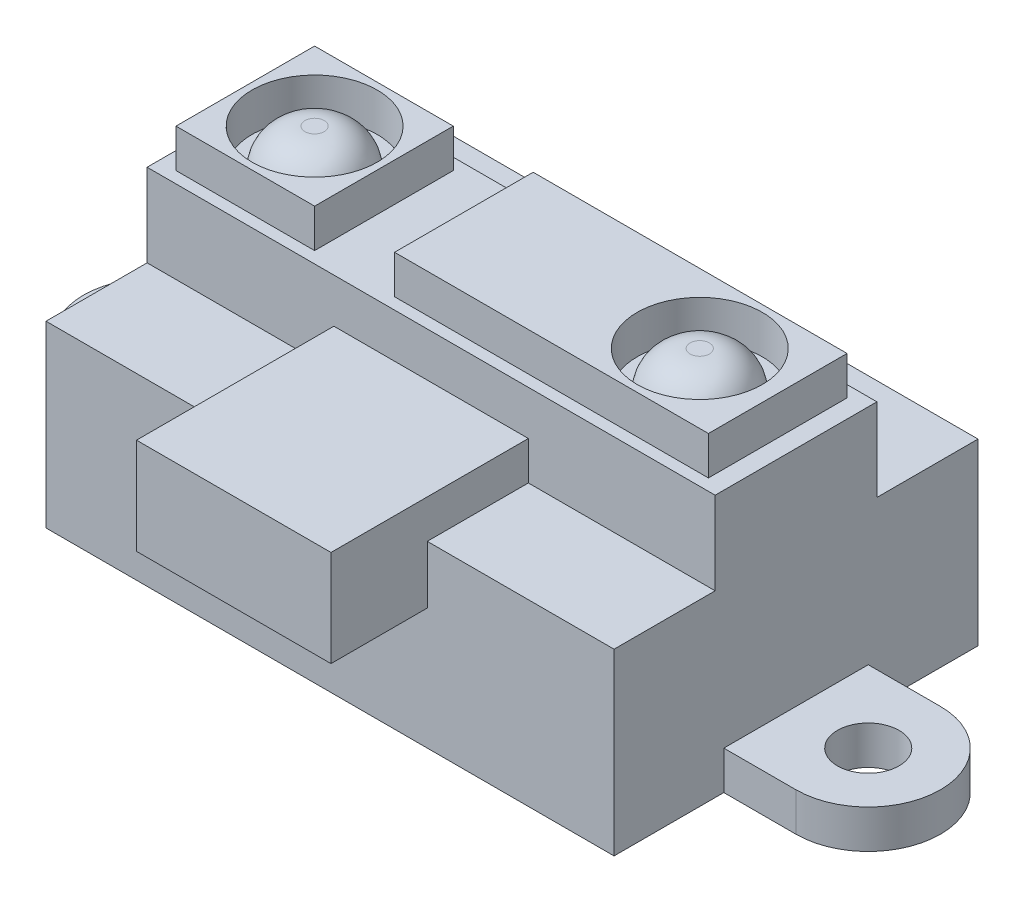
from build123d import *

# Parameters (mm, degrees)
ESQUISSE1_W      = 29.5
ESQUISSE1_H      = 18.9
EXTRUSION1_DEPTH = 9.3
ESQUISSE2_W      = 29.5
ESQUISSE2_H      = 8.4
EXTRUSION2_DEPTH = 4.3
ESQUISSE3_W      = 7.2
ESQUISSE3_H      = 7.2
ESQUISSE3_R      = 3.25
ESQUISSE3_W_2    = 16.3
EXTRUSION3_DEPTH = 2
ESQUISSE4_R      = 2.5
EXTRUSION4_DEPTH = 2
CONG_1_R         = 2
ESQUISSE5_R      = 1.6
EXTRUSION5_DEPTH = 2
ESQUISSE6_W      = 10.1
ESQUISSE6_H      = 10.25
EXTRUSION6_DEPTH = 2
ESQUISSE7_W      = 10.1
ESQUISSE7_H      = 5
EXTRUSION7_DEPTH = 3


with BuildPart() as part:
    # Esquisse1 → Extrusion1 (new body)
    with BuildSketch(Plane(origin=(0, 0, 0), x_dir=(1, 0, 0), z_dir=(0, 1, 0))):
        with Locations((14.75, 9.45)):
            Rectangle(ESQUISSE1_W, ESQUISSE1_H)
    extrude(amount=EXTRUSION1_DEPTH)

    # Esquisse2 → Extrusion2 (add)
    with BuildSketch(Plane(origin=(0, 9.3, 0), x_dir=(1, 0, 0), z_dir=(0, 1, 0))):
        with Locations((14.75, 9.45)):
            Rectangle(ESQUISSE2_W, ESQUISSE2_H)
    extrude(amount=EXTRUSION2_DEPTH)

    # Esquisse3 → Extrusion3 (add)
    # profile 1 of 2: a face of its own
    with BuildSketch(Plane(origin=(0, 13.6, 0), x_dir=(1, 0, 0), z_dir=(0, 1, 0))):
        with Locations((4.5, 9.45)):
            Rectangle(ESQUISSE3_W, ESQUISSE3_H)
        with Locations(Location((4.5, 9.45, 0), (0, 0, 270))):
            Circle(ESQUISSE3_R, mode=Mode.SUBTRACT)
    # profile 2 of 2: a face of its own
    with BuildSketch(Plane(origin=(0, 13.6, 0), x_dir=(1, 0, 0), z_dir=(0, 1, 0))):
        with Locations((20.4, 9.45)):
            Rectangle(ESQUISSE3_W_2, ESQUISSE3_H)
        with Locations(Location((24.5, 9.45, 0), (0, 0, 270))):
            Circle(ESQUISSE3_R, mode=Mode.SUBTRACT)
    extrude(amount=EXTRUSION3_DEPTH)

    # Esquisse4 → Extrusion4 (add)
    with BuildSketch(Plane(origin=(0, 13.6, 0), x_dir=(1, 0, 0), z_dir=(0, 1, 0))):
        with Locations(Location((4.5, 9.45, 0), (0, 0, 90))):
            Circle(ESQUISSE4_R)
        with Locations(Location((24.5, 9.45, 0), (0, 0, 90))):
            Circle(ESQUISSE4_R)
    extrude(amount=EXTRUSION4_DEPTH)

    # Congé1
    cong_1_edges = [part.edges().sort_by_distance(p)[0] for p in [
        (4.5, 15.6, -6.95),
        (24.5, 15.6, -6.95),
    ]]
    fillet(cong_1_edges, radius=CONG_1_R - 0.0001)  # a hair under: the kernel refuses the full size

    # Esquisse5 → Extrusion5 (add)
    # profile 1 of 2: a face of its own
    with BuildSketch(Plane.XZ):
        with BuildLine():
            Line((0, -5.7), (-3.75, -5.7))
            ThreePointArc((-3.75, -5.7), (-7.5, -9.45), (-3.75, -13.2))
            Line((-3.75, -13.2), (0, -13.2))
            Line((0, -13.2), (0, -5.7))
        make_face()
        with Locations(Location((-3.75, -9.45, 0), (0, 0, 270))):
            Circle(ESQUISSE5_R, mode=Mode.SUBTRACT)
    # profile 2 of 2: a face of its own
    with BuildSketch(Plane.XZ):
        with BuildLine():
            Line((29.5, -5.7), (33.25, -5.7))
            ThreePointArc((33.25, -5.7), (37, -9.45), (33.25, -13.2))
            Line((33.25, -13.2), (29.5, -13.2))
            Line((29.5, -13.2), (29.5, -5.7))
        make_face()
        with Locations(Location((33.25, -9.45, 0), (0, 0, 90))):
            Circle(ESQUISSE5_R, mode=Mode.SUBTRACT)
    extrude(amount=-EXTRUSION5_DEPTH)

    # Esquisse6 → Extrusion6 (add)
    with BuildSketch(Plane(origin=(0, 9.3, 0), x_dir=(1, 0, 0), z_dir=(0, 1, 0))):
        with Locations((14.75, 0.125)):
            Rectangle(ESQUISSE6_W, ESQUISSE6_H)
    extrude(amount=EXTRUSION6_DEPTH)

    # Esquisse7 → Extrusion7 (add)
    with BuildSketch(Plane.XZ.offset(-9.3)):
        with Locations((14.75, 2.5)):
            Rectangle(ESQUISSE7_W, ESQUISSE7_H)
    extrude(amount=EXTRUSION7_DEPTH)


solid = part.part
